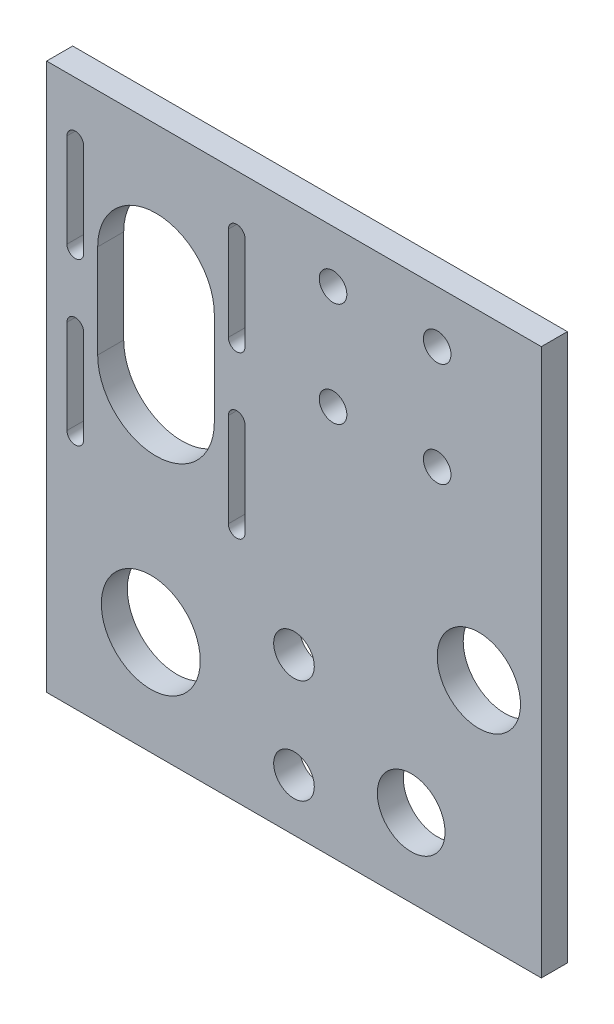
from build123d import *

# Parameters (mm, degrees)
SKETCH_1_W          = 95
SKETCH_1_H          = 75
EXTRUDE_1_DEPTH     = 5
HOLE_WIZARD_M5_1_D  = 5.3
CUT_EXTRUDE_2_DEPTH = 61.724789007
CUT_EXTRUDE_3_REACH = 62.725
SKETCH_4_R          = 8
SKETCH_7_W          = 95
SKETCH_7_H          = 5
EXTRUDE_2_DEPTH     = 30
CUT_EXTRUDE_4_REACH = 84.689
SKETCH_8_R          = 9.5
CUT_EXTRUDE_5_REACH = 84.689
SKETCH_9_R          = 3.9
CUT_EXTRUDE_6_REACH = 84.689
SKETCH_10_R         = 6.5


with BuildPart() as part:
    # 草圖1 → 填料-伸長1 (new body)
    with BuildSketch(Plane.XY):
        Rectangle(SKETCH_1_W, SKETCH_1_H)
    extrude(amount=EXTRUDE_1_DEPTH)

    # M5 餘隙孔1 (through all)
    with Locations(Plane.XY.offset(5)):
        with Locations((27.5, 27.5), (7.5, 7.5), (7.5, 27.5), (27.5, 7.5)):
            Hole(HOLE_WIZARD_M5_1_D / 2)

    # 草圖6 → 除料-伸長2 (cut, through all)
    with BuildSketch(Plane.XY.offset(5)):
        with BuildLine():
            Line((-37.7, -6.5), (-37.7, 11.5))
            ThreePointArc((-37.7, 11.5), (-26.5, 22.7), (-15.3, 11.5))
            Line((-15.3, 11.5), (-15.3, -6.5))
            ThreePointArc((-15.3, -6.5), (-26.5, -17.7), (-37.7, -6.5))
        make_face()
        with BuildLine():
            Line((-40.4, 27), (-40.4, 9))
            ThreePointArc((-40.4, 9), (-42, 7.4), (-43.6, 9))
            Line((-43.6, 9), (-43.6, 27))
            ThreePointArc((-43.6, 27), (-42, 28.6), (-40.4, 27))
        make_face()
        with BuildLine():
            Line((-9.4, 27), (-9.4, 9))
            ThreePointArc((-9.4, 9), (-11, 7.4), (-12.6, 9))
            Line((-12.6, 9), (-12.6, 27))
            ThreePointArc((-12.6, 27), (-11, 28.6), (-9.4, 27))
        make_face()
        with BuildLine():
            Line((-9.4, -4), (-9.4, -22))
            ThreePointArc((-9.4, -22), (-11, -23.6), (-12.6, -22))
            Line((-12.6, -22), (-12.6, -4))
            ThreePointArc((-12.6, -4), (-11, -2.4), (-9.4, -4))
        make_face()
        with BuildLine():
            Line((-40.4, -4), (-40.4, -22))
            ThreePointArc((-40.4, -22), (-42, -23.6), (-43.6, -22))
            Line((-43.6, -22), (-43.6, -4))
            ThreePointArc((-43.6, -4), (-42, -2.4), (-40.4, -4))
        make_face()
    extrude(amount=-CUT_EXTRUDE_2_DEPTH, mode=Mode.SUBTRACT)

    # 草圖4 → 除料-伸長3 (cut, up to next)
    with BuildSketch(Plane.XY.offset(5), mode=Mode.PRIVATE) as cut_extrude_3_sk1:
        with Locations((35.5, -24)):
            Circle(SKETCH_4_R)
    cut_extrude_3_tool1 = extrude(cut_extrude_3_sk1.sketch, amount=-CUT_EXTRUDE_3_REACH, mode=Mode.PRIVATE) & part.part
    add(cut_extrude_3_tool1.solids().sort_by_distance((35.5, -24, 5))[0], mode=Mode.SUBTRACT)

    # 草圖7 → 填料-伸長2 (add)
    with BuildSketch(Plane(origin=(0, -37.5, 0), x_dir=(-1, 0, 0), z_dir=(0, -1, 0))):
        with Locations((0, -2.5)):
            Rectangle(SKETCH_7_W, SKETCH_7_H)
    extrude(amount=EXTRUDE_2_DEPTH)

    # 草圖8 → 除料-伸長4 (cut, up to next)
    with BuildSketch(Plane.XY.offset(5), mode=Mode.PRIVATE) as cut_extrude_4_sk1:
        with Locations((-27.5, -47.5)):
            Circle(SKETCH_8_R)
    cut_extrude_4_tool1 = extrude(cut_extrude_4_sk1.sketch, amount=-CUT_EXTRUDE_4_REACH, mode=Mode.PRIVATE) & part.part
    add(cut_extrude_4_tool1.solids().sort_by_distance((-27.5, -47.5, 5))[0], mode=Mode.SUBTRACT)

    # 草圖9 → 除料-伸長5 (cut, up to next)
    with BuildSketch(Plane.XY.offset(5), mode=Mode.PRIVATE) as cut_extrude_5_sk1:
        with Locations((0, -37.5)):
            Circle(SKETCH_9_R)
    cut_extrude_5_tool1 = extrude(cut_extrude_5_sk1.sketch, amount=-CUT_EXTRUDE_5_REACH, mode=Mode.PRIVATE) & part.part
    # 草圖9 → 除料-伸長5 (cut, up to next)
    with BuildSketch(Plane.XY.offset(5), mode=Mode.PRIVATE) as cut_extrude_5_sk2:
        with Locations((0, -57.5)):
            Circle(SKETCH_9_R)
    cut_extrude_5_tool2 = extrude(cut_extrude_5_sk2.sketch, amount=-CUT_EXTRUDE_5_REACH, mode=Mode.PRIVATE) & part.part
    add(cut_extrude_5_tool1.solids().sort_by_distance((0, -37.5, 5))[0], mode=Mode.SUBTRACT)
    add(cut_extrude_5_tool2.solids().sort_by_distance((0, -57.5, 5))[0], mode=Mode.SUBTRACT)

    # 草圖10 → 除料-伸長6 (cut, up to next)
    with BuildSketch(Plane.XY.offset(5), mode=Mode.PRIVATE) as cut_extrude_6_sk1:
        with Locations((22.5, -52.5)):
            Circle(SKETCH_10_R)
    cut_extrude_6_tool1 = extrude(cut_extrude_6_sk1.sketch, amount=-CUT_EXTRUDE_6_REACH, mode=Mode.PRIVATE) & part.part
    add(cut_extrude_6_tool1.solids().sort_by_distance((22.5, -52.5, 5))[0], mode=Mode.SUBTRACT)


solid = part.part
